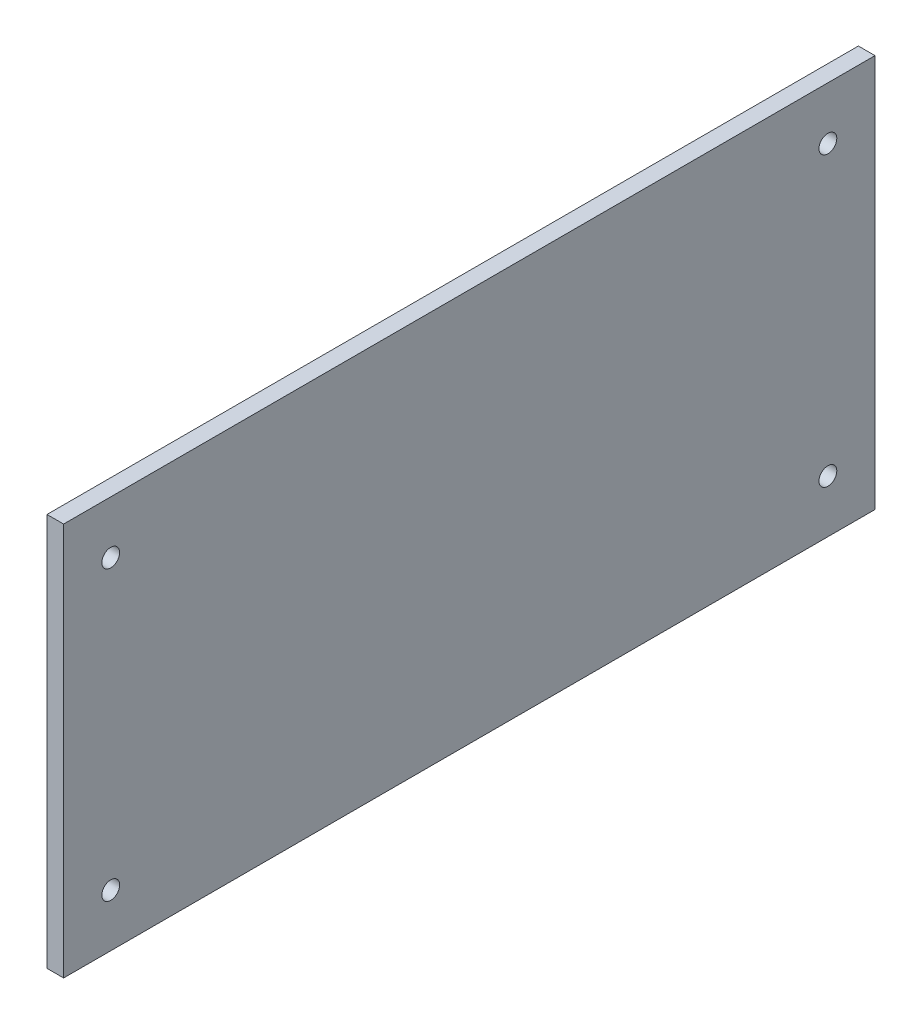
from build123d import *

# Parameters (mm, degrees)
SKETCH3_W           = 155
SKETCH3_H           = 75.1
SKETCH3_R           = 1.7
BOSS_EXTRUDE1_DEPTH = 3.175


with BuildPart() as part:
    # Sketch3 → Boss-Extrude1 (new body)
    with BuildSketch(Plane(origin=(0, 0, 0), x_dir=(0, 0, -1), z_dir=(1, 0, 0))):
        with Locations((77.5, 37.55)):
            Rectangle(SKETCH3_W, SKETCH3_H)
        with Locations((9, 10.05)):
            Circle(SKETCH3_R, mode=Mode.SUBTRACT)
        with Locations((146, 10.05)):
            Circle(SKETCH3_R, mode=Mode.SUBTRACT)
        with Locations((146, 65.05)):
            Circle(SKETCH3_R, mode=Mode.SUBTRACT)
        with Locations((9, 65.05)):
            Circle(SKETCH3_R, mode=Mode.SUBTRACT)
    extrude(amount=BOSS_EXTRUDE1_DEPTH)


solid = part.part
